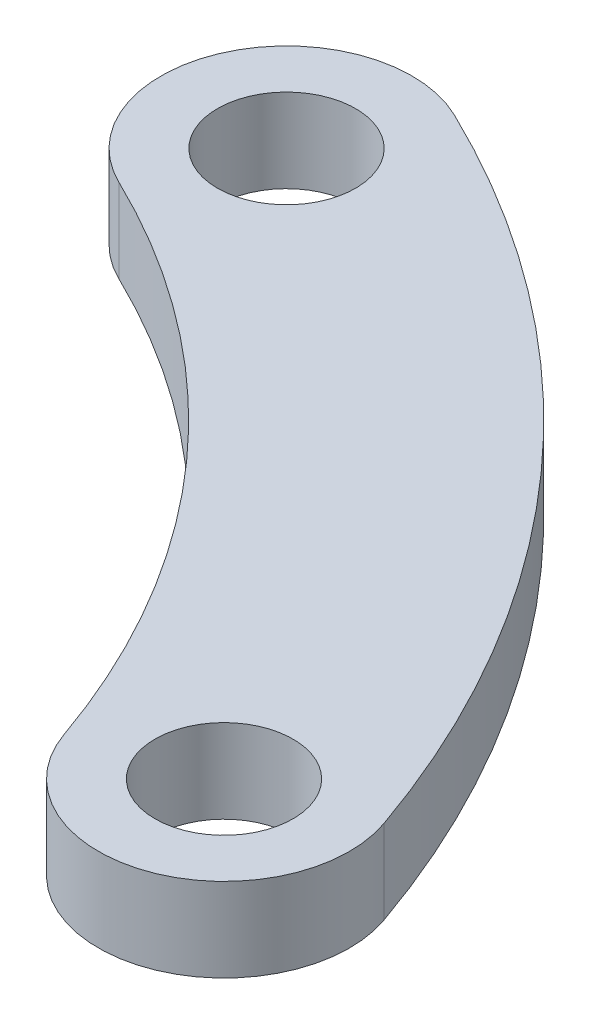
from build123d import *

# Parameters (mm, degrees)
SKETCH1_R           = 1.65
BOSS_EXTRUDE1_DEPTH = 2


with BuildPart() as part:
    # Sketch1 → Boss-Extrude1 (new body)
    with BuildSketch(Plane(origin=(0, 2, 0), x_dir=(1, 0, 0), z_dir=(0, 1, 0))):
        with BuildLine():
            ThreePointArc((25.636162142, 8.939222038), (20.263833323, 18.069298798), (11.806519572, 24.448488616))
            ThreePointArc((11.806519572, 24.448488616), (7.80044132, 23.051585959), (9.197343976, 19.045507706))
            ThreePointArc((9.197343976, 19.045507706), (15.785638113, 14.076083594), (19.970711945, 6.963703355))
            ThreePointArc((19.970711945, 6.963703355), (23.791196384, 5.118737598), (25.636162142, 8.939222038))
        make_face()
        with Locations((10.501931774, 21.746998161)):
            Circle(SKETCH1_R, mode=Mode.SUBTRACT)
        with Locations((22.803437043, 7.951462697)):
            Circle(SKETCH1_R, mode=Mode.SUBTRACT)
    extrude(amount=BOSS_EXTRUDE1_DEPTH)


solid = part.part
